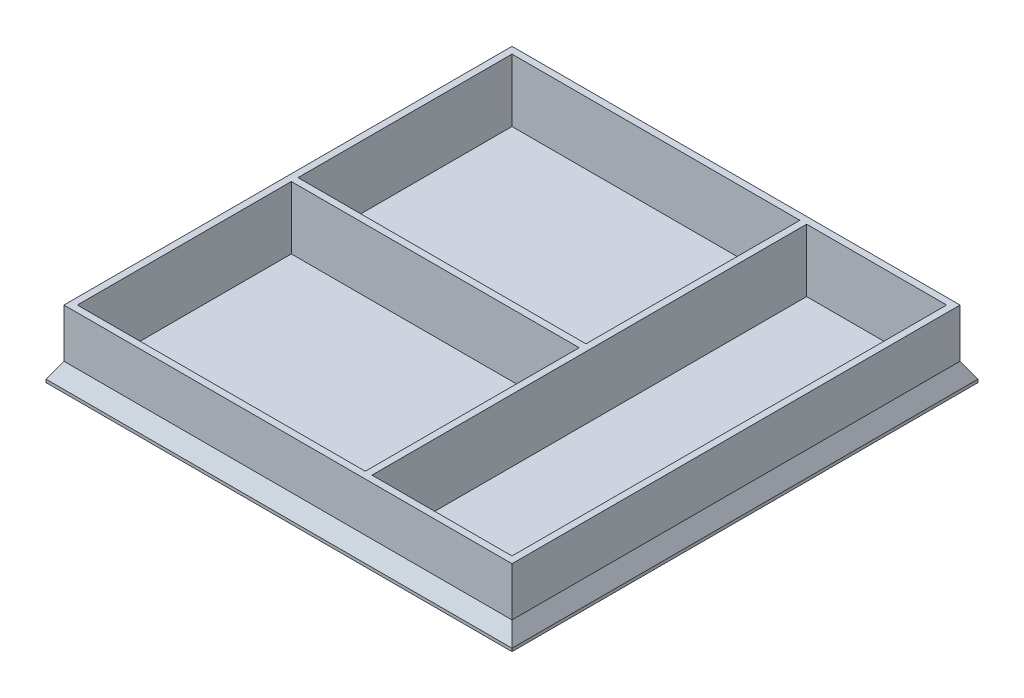
from build123d import *

# Parameters (mm, degrees)
SKICA1_W                = 83.2
SKICA1_H                = 83.2
P_IDAT_VYSUNUT_M1_DEPTH = 0.8
SKICA1_3_W              = 80
SKICA1_3_H              = 80
SKICA1_3_W_2            = 25
SKICA1_3_H_2            = 77.6
SKICA1_3_W_3            = 51.4
SKICA1_3_H_3            = 38.2
P_IDAT_VYSUNUT_M2_DEPTH = 12
SKICA1_4_W              = 83.2
SKICA1_4_H              = 83.2
SKICA1_4_W_2            = 80
SKICA1_4_H_2            = 80
P_IDAT_VYSUNUT_M3_DEPTH = 4
ZKOSEN_2_SIZE           = 3.464101615
ZKOSEN_2_SIZE_2         = 2


with BuildPart() as part:
    # Skica1 → Přidat vysunutím1 (new body)
    with BuildSketch(Plane(origin=(0, 0, 0), x_dir=(1, 0, 0), z_dir=(0, 1, 0))):
        with Locations((-41.6, 41.6)):
            Rectangle(SKICA1_W, SKICA1_H)
    extrude(amount=P_IDAT_VYSUNUT_M1_DEPTH)

    # Skica1<3> → Přidat vysunutím2 (add)
    with BuildSketch(Plane(origin=(0, 0, 0), x_dir=(1, 0, 0), z_dir=(0, 1, 0))):
        with Locations((-41.6, 41.6)):
            Rectangle(SKICA1_3_W, SKICA1_3_H)
        with Locations((-15.3, 41.6)):
            Rectangle(SKICA1_3_W_2, SKICA1_3_H_2, mode=Mode.SUBTRACT)
        with Locations((-54.7, 61.3)):
            Rectangle(SKICA1_3_W_3, SKICA1_3_H_3, mode=Mode.SUBTRACT)
        with Locations((-54.7, 21.9)):
            Rectangle(SKICA1_3_W_3, SKICA1_3_H_3, mode=Mode.SUBTRACT)
    extrude(amount=P_IDAT_VYSUNUT_M2_DEPTH)

    # Skica1<4> → Přidat vysunutím3 (add)
    with BuildSketch(Plane(origin=(0, 0, 0), x_dir=(1, 0, 0), z_dir=(0, 1, 0))):
        with Locations((-41.6, 41.6)):
            Rectangle(SKICA1_4_W, SKICA1_4_H)
        with Locations((-41.6, 41.6)):
            Rectangle(SKICA1_4_W_2, SKICA1_4_H_2, mode=Mode.SUBTRACT)
    extrude(amount=P_IDAT_VYSUNUT_M3_DEPTH)

    # Zkosení2
    # the kernel refuses this chamfer: 3.464101615, 2 mm, written as the material it takes off along each edge
    with BuildSketch(Plane(origin=(-83.2, 4, 8.961927941), x_dir=(-0.0193267656126997, -0.9998132206222079, 0), z_dir=(0, 0, -1))) as zkosen_2_piece_1_section:
        Polygon((ZKOSEN_2_SIZE * 0.999813220662, -ZKOSEN_2_SIZE * 0.0193267656135), (-ZKOSEN_2_SIZE_2 * 0.0193267656127, -ZKOSEN_2_SIZE_2 * 0.999813220622), (0, 0), align=None)
    zkosen_2_piece_1 = extrude(amount=101.123855882, mode=Mode.PRIVATE)
    zkosen_2_piece_1 = split(zkosen_2_piece_1, bisect_by=Plane(origin=(-81.6, 2.781142692, 3.680963971), z_dir=(-1, 0, 0)), keep=Keep.TOP, mode=Mode.PRIVATE)
    zkosen_2_piece_1 = split(zkosen_2_piece_1, bisect_by=Plane(origin=(-82.620942714, 2.781142692, -1.6), z_dir=(0, 0, 1)), keep=Keep.TOP, mode=Mode.PRIVATE)
    add(zkosen_2_piece_1, mode=Mode.SUBTRACT)
    with BuildSketch(Plane(origin=(-83.2, 4, 8.961927941), x_dir=(-0.0193267656126997, -0.9998132206222079, 0), z_dir=(0, 0, -1))) as zkosen_2_piece_2_section:
        Polygon((ZKOSEN_2_SIZE * 0.999813220662, -ZKOSEN_2_SIZE * 0.0193267656135), (-ZKOSEN_2_SIZE_2 * 0.0193267656127, -ZKOSEN_2_SIZE_2 * 0.999813220622), (0, 0), align=None)
    zkosen_2_piece_2 = extrude(amount=101.123855882, mode=Mode.PRIVATE)
    zkosen_2_piece_2 = split(zkosen_2_piece_2, bisect_by=Plane(origin=(-81.6, 3.870737408, 3.680963971), z_dir=(1, 0, 0)), keep=Keep.TOP, mode=Mode.PRIVATE)
    zkosen_2_piece_2 = split(zkosen_2_piece_2, bisect_by=Plane(origin=(-81.431601135, 3.870737408, -1.6), z_dir=(0, 0, 1)), keep=Keep.TOP, mode=Mode.PRIVATE)
    add(zkosen_2_piece_2, mode=Mode.SUBTRACT)
    with BuildSketch(Plane(origin=(-83.2, 4, 8.961927941), x_dir=(-0.0193267656126997, -0.9998132206222079, 0), z_dir=(0, 0, -1))) as zkosen_2_piece_3_section:
        Polygon((ZKOSEN_2_SIZE * 0.999813220662, -ZKOSEN_2_SIZE * 0.0193267656135), (-ZKOSEN_2_SIZE_2 * 0.0193267656127, -ZKOSEN_2_SIZE_2 * 0.999813220622), (0, 0), align=None)
    zkosen_2_piece_3 = extrude(amount=101.123855882, mode=Mode.PRIVATE)
    zkosen_2_piece_3 = split(zkosen_2_piece_3, bisect_by=Plane(origin=(-81.6, 2.781142692, -41.6), z_dir=(-1, 0, 0)), keep=Keep.TOP, mode=Mode.PRIVATE)
    zkosen_2_piece_3 = split(zkosen_2_piece_3, bisect_by=Plane(origin=(-82.620942714, 2.781142692, -1.6), z_dir=(0, 0, -1)), keep=Keep.TOP, mode=Mode.PRIVATE)
    zkosen_2_piece_3 = split(zkosen_2_piece_3, bisect_by=Plane(origin=(-82.620942714, 2.781142692, -81.6), z_dir=(0, 0, 1)), keep=Keep.TOP, mode=Mode.PRIVATE)
    add(zkosen_2_piece_3, mode=Mode.SUBTRACT)
    with BuildSketch(Plane(origin=(-83.2, 4, 8.961927941), x_dir=(-0.0193267656126997, -0.9998132206222079, 0), z_dir=(0, 0, -1))) as zkosen_2_piece_4_section:
        Polygon((ZKOSEN_2_SIZE * 0.999813220662, -ZKOSEN_2_SIZE * 0.0193267656135), (-ZKOSEN_2_SIZE_2 * 0.0193267656127, -ZKOSEN_2_SIZE_2 * 0.999813220622), (0, 0), align=None)
    zkosen_2_piece_4 = extrude(amount=101.123855882, mode=Mode.PRIVATE)
    zkosen_2_piece_4 = split(zkosen_2_piece_4, bisect_by=Plane(origin=(-81.6, 2.781142692, -86.880963971), z_dir=(-1, 0, 0)), keep=Keep.TOP, mode=Mode.PRIVATE)
    zkosen_2_piece_4 = split(zkosen_2_piece_4, bisect_by=Plane(origin=(-82.620942714, 2.781142692, -81.6), z_dir=(0, 0, -1)), keep=Keep.TOP, mode=Mode.PRIVATE)
    add(zkosen_2_piece_4, mode=Mode.SUBTRACT)
    with BuildSketch(Plane(origin=(-83.2, 4, 8.961927941), x_dir=(-0.0193267656126997, -0.9998132206222079, 0), z_dir=(0, 0, -1))) as zkosen_2_piece_5_section:
        Polygon((ZKOSEN_2_SIZE * 0.999813220662, -ZKOSEN_2_SIZE * 0.0193267656135), (-ZKOSEN_2_SIZE_2 * 0.0193267656127, -ZKOSEN_2_SIZE_2 * 0.999813220622), (0, 0), align=None)
    zkosen_2_piece_5 = extrude(amount=101.123855882, mode=Mode.PRIVATE)
    zkosen_2_piece_5 = split(zkosen_2_piece_5, bisect_by=Plane(origin=(-81.6, 3.870737408, -86.880963971), z_dir=(1, 0, 0)), keep=Keep.TOP, mode=Mode.PRIVATE)
    zkosen_2_piece_5 = split(zkosen_2_piece_5, bisect_by=Plane(origin=(-81.431601135, 3.870737408, -81.6), z_dir=(0, 0, -1)), keep=Keep.TOP, mode=Mode.PRIVATE)
    add(zkosen_2_piece_5, mode=Mode.SUBTRACT)
    with BuildSketch(Plane(origin=(-92.161927941, 4, -83.2), x_dir=(0, -0.9998132206222079, -0.0193267656126997), z_dir=(1, 0, 0))) as zkosen_2_piece_6_section:
        Polygon((ZKOSEN_2_SIZE * 0.999813220662, -ZKOSEN_2_SIZE * 0.0193267656135), (-ZKOSEN_2_SIZE_2 * 0.0193267656127, -ZKOSEN_2_SIZE_2 * 0.999813220622), (0, 0), align=None)
    zkosen_2_piece_6 = extrude(amount=101.123855882, mode=Mode.PRIVATE)
    zkosen_2_piece_6 = split(zkosen_2_piece_6, bisect_by=Plane(origin=(-81.6, 2.781142692, -82.620942714), z_dir=(-1, 0, 0)), keep=Keep.TOP, mode=Mode.PRIVATE)
    zkosen_2_piece_6 = split(zkosen_2_piece_6, bisect_by=Plane(origin=(-86.880963971, 2.781142692, -81.6), z_dir=(0, 0, -1)), keep=Keep.TOP, mode=Mode.PRIVATE)
    add(zkosen_2_piece_6, mode=Mode.SUBTRACT)
    with BuildSketch(Plane(origin=(-92.161927941, 4, -83.2), x_dir=(0, -0.9998132206222079, -0.0193267656126997), z_dir=(1, 0, 0))) as zkosen_2_piece_7_section:
        Polygon((ZKOSEN_2_SIZE * 0.999813220662, -ZKOSEN_2_SIZE * 0.0193267656135), (-ZKOSEN_2_SIZE_2 * 0.0193267656127, -ZKOSEN_2_SIZE_2 * 0.999813220622), (0, 0), align=None)
    zkosen_2_piece_7 = extrude(amount=101.123855882, mode=Mode.PRIVATE)
    zkosen_2_piece_7 = split(zkosen_2_piece_7, bisect_by=Plane(origin=(-81.6, 3.870737408, -81.431601135), z_dir=(-1, 0, 0)), keep=Keep.TOP, mode=Mode.PRIVATE)
    zkosen_2_piece_7 = split(zkosen_2_piece_7, bisect_by=Plane(origin=(-86.880963971, 3.870737408, -81.6), z_dir=(0, 0, 1)), keep=Keep.TOP, mode=Mode.PRIVATE)
    add(zkosen_2_piece_7, mode=Mode.SUBTRACT)
    with BuildSketch(Plane(origin=(-92.161927941, 4, -83.2), x_dir=(0, -0.9998132206222079, -0.0193267656126997), z_dir=(1, 0, 0))) as zkosen_2_piece_8_section:
        Polygon((ZKOSEN_2_SIZE * 0.999813220662, -ZKOSEN_2_SIZE * 0.0193267656135), (-ZKOSEN_2_SIZE_2 * 0.0193267656127, -ZKOSEN_2_SIZE_2 * 0.999813220622), (0, 0), align=None)
    zkosen_2_piece_8 = extrude(amount=101.123855882, mode=Mode.PRIVATE)
    zkosen_2_piece_8 = split(zkosen_2_piece_8, bisect_by=Plane(origin=(-81.6, 2.781142692, -82.620942714), z_dir=(1, 0, 0)), keep=Keep.TOP, mode=Mode.PRIVATE)
    zkosen_2_piece_8 = split(zkosen_2_piece_8, bisect_by=Plane(origin=(-1.6, 2.781142692, -82.620942714), z_dir=(-1, 0, 0)), keep=Keep.TOP, mode=Mode.PRIVATE)
    zkosen_2_piece_8 = split(zkosen_2_piece_8, bisect_by=Plane(origin=(-41.6, 2.781142692, -81.6), z_dir=(0, 0, -1)), keep=Keep.TOP, mode=Mode.PRIVATE)
    add(zkosen_2_piece_8, mode=Mode.SUBTRACT)
    with BuildSketch(Plane(origin=(-92.161927941, 4, -83.2), x_dir=(0, -0.9998132206222079, -0.0193267656126997), z_dir=(1, 0, 0))) as zkosen_2_piece_9_section:
        Polygon((ZKOSEN_2_SIZE * 0.999813220662, -ZKOSEN_2_SIZE * 0.0193267656135), (-ZKOSEN_2_SIZE_2 * 0.0193267656127, -ZKOSEN_2_SIZE_2 * 0.999813220622), (0, 0), align=None)
    zkosen_2_piece_9 = extrude(amount=101.123855882, mode=Mode.PRIVATE)
    zkosen_2_piece_9 = split(zkosen_2_piece_9, bisect_by=Plane(origin=(-1.6, 2.781142692, -82.620942714), z_dir=(1, 0, 0)), keep=Keep.TOP, mode=Mode.PRIVATE)
    zkosen_2_piece_9 = split(zkosen_2_piece_9, bisect_by=Plane(origin=(3.680963971, 2.781142692, -81.6), z_dir=(0, 0, -1)), keep=Keep.TOP, mode=Mode.PRIVATE)
    add(zkosen_2_piece_9, mode=Mode.SUBTRACT)
    with BuildSketch(Plane(origin=(-92.161927941, 4, -83.2), x_dir=(0, -0.9998132206222079, -0.0193267656126997), z_dir=(1, 0, 0))) as zkosen_2_piece_10_section:
        Polygon((ZKOSEN_2_SIZE * 0.999813220662, -ZKOSEN_2_SIZE * 0.0193267656135), (-ZKOSEN_2_SIZE_2 * 0.0193267656127, -ZKOSEN_2_SIZE_2 * 0.999813220622), (0, 0), align=None)
    zkosen_2_piece_10 = extrude(amount=101.123855882, mode=Mode.PRIVATE)
    zkosen_2_piece_10 = split(zkosen_2_piece_10, bisect_by=Plane(origin=(-1.6, 3.870737408, -81.431601135), z_dir=(1, 0, 0)), keep=Keep.TOP, mode=Mode.PRIVATE)
    zkosen_2_piece_10 = split(zkosen_2_piece_10, bisect_by=Plane(origin=(3.680963971, 3.870737408, -81.6), z_dir=(0, 0, 1)), keep=Keep.TOP, mode=Mode.PRIVATE)
    add(zkosen_2_piece_10, mode=Mode.SUBTRACT)
    with BuildSketch(Plane(origin=(0, 4, -92.161927941), x_dir=(-0.9983227437537926, 0.057893862402671484, 0), z_dir=(0, 0, 1))) as zkosen_2_piece_11_section:
        Polygon((ZKOSEN_2_SIZE_2 * 0.998322743754, ZKOSEN_2_SIZE_2 * 0.0578938624027), (-ZKOSEN_2_SIZE * 0.057893862405, ZKOSEN_2_SIZE * 0.998322743793), (0, 0), align=None)
    zkosen_2_piece_11 = extrude(amount=101.123855882, mode=Mode.PRIVATE)
    zkosen_2_piece_11 = split(zkosen_2_piece_11, bisect_by=Plane(origin=(-1.6, 3.870737408, -86.880963971), z_dir=(-1, 0, 0)), keep=Keep.TOP, mode=Mode.PRIVATE)
    zkosen_2_piece_11 = split(zkosen_2_piece_11, bisect_by=Plane(origin=(-1.768398865, 3.870737408, -81.6), z_dir=(0, 0, -1)), keep=Keep.TOP, mode=Mode.PRIVATE)
    add(zkosen_2_piece_11, mode=Mode.SUBTRACT)
    with BuildSketch(Plane(origin=(0, 4, -92.161927941), x_dir=(-0.9983227437537926, 0.057893862402671484, 0), z_dir=(0, 0, 1))) as zkosen_2_piece_12_section:
        Polygon((ZKOSEN_2_SIZE_2 * 0.998322743754, ZKOSEN_2_SIZE_2 * 0.0578938624027), (-ZKOSEN_2_SIZE * 0.057893862405, ZKOSEN_2_SIZE * 0.998322743793), (0, 0), align=None)
    zkosen_2_piece_12 = extrude(amount=101.123855882, mode=Mode.PRIVATE)
    zkosen_2_piece_12 = split(zkosen_2_piece_12, bisect_by=Plane(origin=(-1.6, 2.781142692, -86.880963971), z_dir=(1, 0, 0)), keep=Keep.TOP, mode=Mode.PRIVATE)
    zkosen_2_piece_12 = split(zkosen_2_piece_12, bisect_by=Plane(origin=(-0.579057286, 2.781142692, -81.6), z_dir=(0, 0, -1)), keep=Keep.TOP, mode=Mode.PRIVATE)
    add(zkosen_2_piece_12, mode=Mode.SUBTRACT)
    with BuildSketch(Plane(origin=(0, 4, -92.161927941), x_dir=(-0.9983227437537926, 0.057893862402671484, 0), z_dir=(0, 0, 1))) as zkosen_2_piece_13_section:
        Polygon((ZKOSEN_2_SIZE_2 * 0.998322743754, ZKOSEN_2_SIZE_2 * 0.0578938624027), (-ZKOSEN_2_SIZE * 0.057893862405, ZKOSEN_2_SIZE * 0.998322743793), (0, 0), align=None)
    zkosen_2_piece_13 = extrude(amount=101.123855882, mode=Mode.PRIVATE)
    zkosen_2_piece_13 = split(zkosen_2_piece_13, bisect_by=Plane(origin=(-0.579057286, 2.781142692, -1.6), z_dir=(0, 0, -1)), keep=Keep.TOP, mode=Mode.PRIVATE)
    zkosen_2_piece_13 = split(zkosen_2_piece_13, bisect_by=Plane(origin=(-1.6, 2.781142692, -41.6), z_dir=(1, 0, 0)), keep=Keep.TOP, mode=Mode.PRIVATE)
    zkosen_2_piece_13 = split(zkosen_2_piece_13, bisect_by=Plane(origin=(-0.579057286, 2.781142692, -81.6), z_dir=(0, 0, 1)), keep=Keep.TOP, mode=Mode.PRIVATE)
    add(zkosen_2_piece_13, mode=Mode.SUBTRACT)
    with BuildSketch(Plane(origin=(0, 4, -92.161927941), x_dir=(-0.9983227437537926, 0.057893862402671484, 0), z_dir=(0, 0, 1))) as zkosen_2_piece_14_section:
        Polygon((ZKOSEN_2_SIZE_2 * 0.998322743754, ZKOSEN_2_SIZE_2 * 0.0578938624027), (-ZKOSEN_2_SIZE * 0.057893862405, ZKOSEN_2_SIZE * 0.998322743793), (0, 0), align=None)
    zkosen_2_piece_14 = extrude(amount=101.123855882, mode=Mode.PRIVATE)
    zkosen_2_piece_14 = split(zkosen_2_piece_14, bisect_by=Plane(origin=(-1.768398865, 3.870737408, -1.6), z_dir=(0, 0, 1)), keep=Keep.TOP, mode=Mode.PRIVATE)
    zkosen_2_piece_14 = split(zkosen_2_piece_14, bisect_by=Plane(origin=(-1.6, 3.870737408, 3.680963971), z_dir=(-1, 0, 0)), keep=Keep.TOP, mode=Mode.PRIVATE)
    add(zkosen_2_piece_14, mode=Mode.SUBTRACT)
    with BuildSketch(Plane(origin=(0, 4, -92.161927941), x_dir=(-0.9983227437537926, 0.057893862402671484, 0), z_dir=(0, 0, 1))) as zkosen_2_piece_15_section:
        Polygon((ZKOSEN_2_SIZE_2 * 0.998322743754, ZKOSEN_2_SIZE_2 * 0.0578938624027), (-ZKOSEN_2_SIZE * 0.057893862405, ZKOSEN_2_SIZE * 0.998322743793), (0, 0), align=None)
    zkosen_2_piece_15 = extrude(amount=101.123855882, mode=Mode.PRIVATE)
    zkosen_2_piece_15 = split(zkosen_2_piece_15, bisect_by=Plane(origin=(-0.579057286, 2.781142692, -1.6), z_dir=(0, 0, 1)), keep=Keep.TOP, mode=Mode.PRIVATE)
    zkosen_2_piece_15 = split(zkosen_2_piece_15, bisect_by=Plane(origin=(-1.6, 2.781142692, 3.680963971), z_dir=(1, 0, 0)), keep=Keep.TOP, mode=Mode.PRIVATE)
    add(zkosen_2_piece_15, mode=Mode.SUBTRACT)
    with BuildSketch(Plane(origin=(8.961927941, 4, 0), x_dir=(0, -0.9998132206222079, 0.01932676561270061), z_dir=(-1, 0, 0))) as zkosen_2_piece_16_section:
        Polygon((ZKOSEN_2_SIZE * 0.999813220662, -ZKOSEN_2_SIZE * 0.0193267656135), (-ZKOSEN_2_SIZE_2 * 0.0193267656127, -ZKOSEN_2_SIZE_2 * 0.999813220622), (0, 0), align=None)
    zkosen_2_piece_16 = extrude(amount=101.123855882, mode=Mode.PRIVATE)
    zkosen_2_piece_16 = split(zkosen_2_piece_16, bisect_by=Plane(origin=(3.680963971, 2.781142692, -1.6), z_dir=(0, 0, 1)), keep=Keep.TOP, mode=Mode.PRIVATE)
    zkosen_2_piece_16 = split(zkosen_2_piece_16, bisect_by=Plane(origin=(-1.6, 2.781142692, -0.579057286), z_dir=(1, 0, 0)), keep=Keep.TOP, mode=Mode.PRIVATE)
    add(zkosen_2_piece_16, mode=Mode.SUBTRACT)
    with BuildSketch(Plane(origin=(8.961927941, 4, 0), x_dir=(0, -0.9998132206222079, 0.01932676561270061), z_dir=(-1, 0, 0))) as zkosen_2_piece_17_section:
        Polygon((ZKOSEN_2_SIZE * 0.999813220662, -ZKOSEN_2_SIZE * 0.0193267656135), (-ZKOSEN_2_SIZE_2 * 0.0193267656127, -ZKOSEN_2_SIZE_2 * 0.999813220622), (0, 0), align=None)
    zkosen_2_piece_17 = extrude(amount=101.123855882, mode=Mode.PRIVATE)
    zkosen_2_piece_17 = split(zkosen_2_piece_17, bisect_by=Plane(origin=(3.680963971, 3.870737408, -1.6), z_dir=(0, 0, -1)), keep=Keep.TOP, mode=Mode.PRIVATE)
    zkosen_2_piece_17 = split(zkosen_2_piece_17, bisect_by=Plane(origin=(-1.6, 3.870737408, -1.768398865), z_dir=(1, 0, 0)), keep=Keep.TOP, mode=Mode.PRIVATE)
    add(zkosen_2_piece_17, mode=Mode.SUBTRACT)
    with BuildSketch(Plane(origin=(8.961927941, 4, 0), x_dir=(0, -0.9998132206222079, 0.01932676561270061), z_dir=(-1, 0, 0))) as zkosen_2_piece_18_section:
        Polygon((ZKOSEN_2_SIZE * 0.999813220662, -ZKOSEN_2_SIZE * 0.0193267656135), (-ZKOSEN_2_SIZE_2 * 0.0193267656127, -ZKOSEN_2_SIZE_2 * 0.999813220622), (0, 0), align=None)
    zkosen_2_piece_18 = extrude(amount=101.123855882, mode=Mode.PRIVATE)
    zkosen_2_piece_18 = split(zkosen_2_piece_18, bisect_by=Plane(origin=(-81.6, 2.781142692, -0.579057286), z_dir=(1, 0, 0)), keep=Keep.TOP, mode=Mode.PRIVATE)
    zkosen_2_piece_18 = split(zkosen_2_piece_18, bisect_by=Plane(origin=(-41.6, 2.781142692, -1.6), z_dir=(0, 0, 1)), keep=Keep.TOP, mode=Mode.PRIVATE)
    zkosen_2_piece_18 = split(zkosen_2_piece_18, bisect_by=Plane(origin=(-1.6, 2.781142692, -0.579057286), z_dir=(-1, 0, 0)), keep=Keep.TOP, mode=Mode.PRIVATE)
    add(zkosen_2_piece_18, mode=Mode.SUBTRACT)
    with BuildSketch(Plane(origin=(8.961927941, 4, 0), x_dir=(0, -0.9998132206222079, 0.01932676561270061), z_dir=(-1, 0, 0))) as zkosen_2_piece_19_section:
        Polygon((ZKOSEN_2_SIZE * 0.999813220662, -ZKOSEN_2_SIZE * 0.0193267656135), (-ZKOSEN_2_SIZE_2 * 0.0193267656127, -ZKOSEN_2_SIZE_2 * 0.999813220622), (0, 0), align=None)
    zkosen_2_piece_19 = extrude(amount=101.123855882, mode=Mode.PRIVATE)
    zkosen_2_piece_19 = split(zkosen_2_piece_19, bisect_by=Plane(origin=(-81.6, 2.781142692, -0.579057286), z_dir=(-1, 0, 0)), keep=Keep.TOP, mode=Mode.PRIVATE)
    zkosen_2_piece_19 = split(zkosen_2_piece_19, bisect_by=Plane(origin=(-86.880963971, 2.781142692, -1.6), z_dir=(0, 0, 1)), keep=Keep.TOP, mode=Mode.PRIVATE)
    add(zkosen_2_piece_19, mode=Mode.SUBTRACT)
    with BuildSketch(Plane(origin=(8.961927941, 4, 0), x_dir=(0, -0.9998132206222079, 0.01932676561270061), z_dir=(-1, 0, 0))) as zkosen_2_piece_20_section:
        Polygon((ZKOSEN_2_SIZE * 0.999813220662, -ZKOSEN_2_SIZE * 0.0193267656135), (-ZKOSEN_2_SIZE_2 * 0.0193267656127, -ZKOSEN_2_SIZE_2 * 0.999813220622), (0, 0), align=None)
    zkosen_2_piece_20 = extrude(amount=101.123855882, mode=Mode.PRIVATE)
    zkosen_2_piece_20 = split(zkosen_2_piece_20, bisect_by=Plane(origin=(-81.6, 3.870737408, -1.768398865), z_dir=(-1, 0, 0)), keep=Keep.TOP, mode=Mode.PRIVATE)
    zkosen_2_piece_20 = split(zkosen_2_piece_20, bisect_by=Plane(origin=(-86.880963971, 3.870737408, -1.6), z_dir=(0, 0, -1)), keep=Keep.TOP, mode=Mode.PRIVATE)
    add(zkosen_2_piece_20, mode=Mode.SUBTRACT)


solid = part.part
